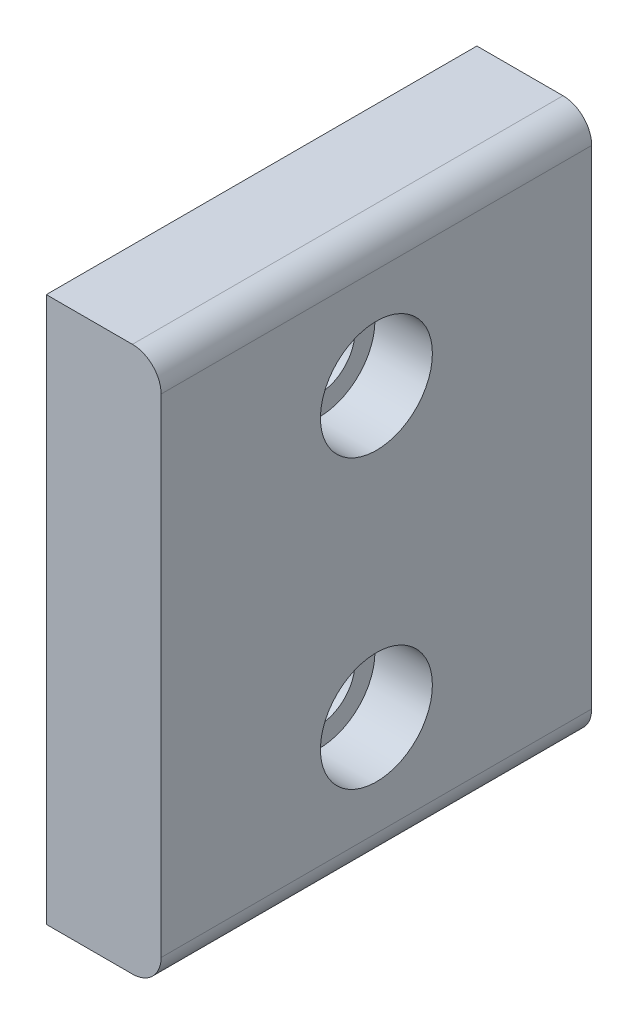
from build123d import *

# Parameters (mm, degrees)
SKETCH_1_W          = 15
SKETCH_1_H          = 19
SKETCH_1_R          = 1.25
EXTRUDE_1_DEPTH     = 4
SKETCH_2_R          = 1.95
CUT_EXTRUDE_1_DEPTH = 2
FILLET_1_R          = 1


with BuildPart() as part:
    # Эскиз1 → Бобышка-Вытянуть1 (new body)
    with BuildSketch(Plane(origin=(0, 0, 0), x_dir=(0, 0, -1), z_dir=(1, 0, 0))):
        Rectangle(SKETCH_1_W, SKETCH_1_H)
        with Locations((0, 5)):
            Circle(SKETCH_1_R, mode=Mode.SUBTRACT)
        with Locations((0, -5)):
            Circle(SKETCH_1_R, mode=Mode.SUBTRACT)
    extrude(amount=EXTRUDE_1_DEPTH)

    # Эскиз2 → Вырез-Вытянуть1 (cut)
    with BuildSketch(Plane(origin=(4, 0, 0), x_dir=(0, 0, -1), z_dir=(1, 0, 0))):
        with Locations((0, 5)):
            Circle(SKETCH_2_R)
        with Locations((0, -5)):
            Circle(SKETCH_2_R)
    extrude(amount=-CUT_EXTRUDE_1_DEPTH, mode=Mode.SUBTRACT)

    # Скругление1
    fillet_1_edges = [part.edges().sort_by_distance(p)[0] for p in [
        (4, -9.5, 0),
        (4, 9.5, 0),
    ]]
    fillet(fillet_1_edges, radius=FILLET_1_R)


solid = part.part
